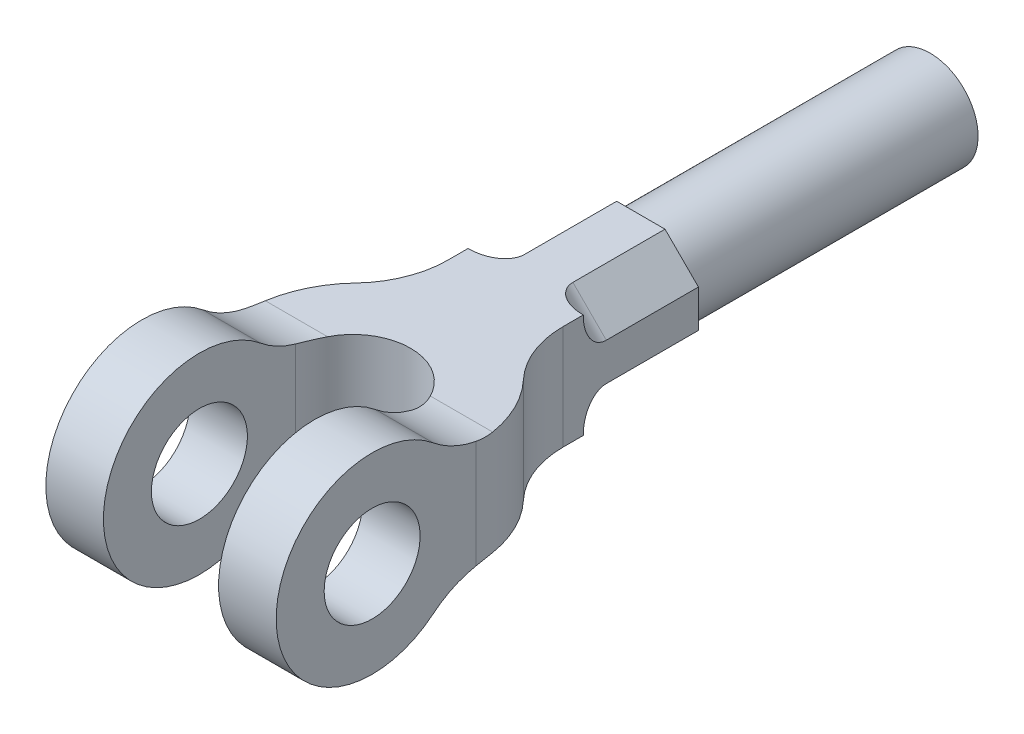
from build123d import *

# Parameters (mm, degrees)
SKETCH1_W               = 1200
SKETCH1_H               = 2500
BOSS_EXTRUDE1_DEPTH     = 1000
CUT_EXTRUDE1_DEPTH      = 1000
CUT_EXTRUDE5_DEPTH      = 2031.296104468
CUT_EXTRUDE5_DEPTH_BACK = 1200
SKETCH3_R               = 250
CUT_EXTRUDE6_DEPTH      = 600
SKETCH4_3_R             = 250
BOSS_EXTRUDE2_DEPTH     = 1507
FILLET1_R               = 120


with BuildPart() as part:
    # Sketch1 → Boss-Extrude1 (new body)
    with BuildSketch(Plane(origin=(0, 0, 0), x_dir=(1, 0, 0), z_dir=(0, 1, 0))):
        with Locations((57.423971377, 46.958855098)):
            Rectangle(SKETCH1_W, SKETCH1_H)
    extrude(amount=BOSS_EXTRUDE1_DEPTH)

    # Sketch2 → Cut-Extrude1 (cut)
    with BuildSketch(Plane(origin=(0, 1000, 0), x_dir=(1, 0, 0), z_dir=(0, 1, 0))):
        with BuildLine():
            ThreePointArc((357.423971377, -203.041144902), (57.423971377, 96.958855098), (-242.576028623, -203.041144902))
            Line((-242.576028623, -203.041144902), (-242.576028623, -1203.041144902))
            Line((-242.576028623, -1203.041144902), (357.423971377, -1203.041144902))
            Line((357.423971377, -1203.041144902), (357.423971377, -203.041144902))
        make_face()
        with BuildLine():
            Line((657.423971377, 1296.958855098), (357.423971377, 1296.958855098))
            Line((357.423971377, 1296.958855098), (357.423971377, 591.942298625))
            ThreePointArc((357.423971377, 591.942298625), (392.763782735, 407.305062156), (493.787607741, 248.768006113))
            ThreePointArc((493.787607741, 248.768006113), (615.016197748, 58.523538861), (657.423971377, -163.041144902))
            Line((657.423971377, -163.041144902), (657.423971377, 1296.958855098))
        make_face()
        with BuildLine():
            Line((-242.576028623, 591.942298625), (-242.576028623, 1296.958855098))
            Line((-242.576028623, 1296.958855098), (-542.576028623, 1296.958855098))
            Line((-542.576028623, 1296.958855098), (-542.576028623, -163.041144902))
            ThreePointArc((-542.576028623, -163.041144902), (-500.168254993, 58.523538861), (-378.939664986, 248.768006113))
            ThreePointArc((-378.939664986, 248.768006113), (-277.91583998, 407.305062156), (-242.576028623, 591.942298625))
        make_face()
    extrude(amount=-CUT_EXTRUDE1_DEPTH, mode=Mode.SUBTRACT)

    # Sketch3 → Cut-Extrude5 (cut, two sides: drawn at the far end of the back side and taken through both)
    with BuildSketch(Plane(origin=(657.423971377, 0, 0), x_dir=(0, 0, -1), z_dir=(1, 0, 0)).offset(-CUT_EXTRUDE5_DEPTH_BACK)):
        with BuildLine():
            Line((-67.360380322, 771.952048733), (1296.958855098, 771.952048733))
            Line((1296.958855098, 771.952048733), (1296.958855098, 1000))
            Line((1296.958855098, 1000), (-703.041144902, 1000))
            ThreePointArc((-703.041144902, 1000), (-534.203963249, 970.631497131), (-385.200762612, 885.976024367))
            ThreePointArc((-385.200762612, 885.976024367), (-236.197561974, 801.320551602), (-67.360380322, 771.952048733))
        make_face()
        with BuildLine():
            Line((1296.958855098, 0), (1296.958855098, 228.047951267))
            Line((1296.958855098, 228.047951267), (-67.360380322, 228.047951267))
            ThreePointArc((-67.360380322, 228.047951267), (-236.197561974, 198.679448398), (-385.200762612, 114.023975633))
            ThreePointArc((-385.200762612, 114.023975633), (-534.203964843, 29.368502297), (-703.041148287, 0))
            Line((-703.041148287, 0), (1296.958855098, 0))
        make_face()
        with BuildLine():
            ThreePointArc((-1203.041144902, 500), (-1056.594535495, 853.553390593), (-703.041144902, 1000))
            Line((-703.041144902, 1000), (-1203.041144902, 1000))
            Line((-1203.041144902, 1000), (-1203.041144902, 500))
        make_face()
        with BuildLine():
            ThreePointArc((-703.041148287, 0), (-1056.594536692, 146.446610604), (-1203.041144902, 500))
            Line((-1203.041144902, 500), (-1203.041144902, 0))
            Line((-1203.041144902, 0), (-703.041148287, 0))
        make_face()
        with Locations((-703.041144902, 500)):
            Circle(SKETCH3_R)
    extrude(amount=CUT_EXTRUDE5_DEPTH + CUT_EXTRUDE5_DEPTH_BACK, mode=Mode.SUBTRACT)

    # Sketch4 → Cut-Extrude6 (cut)
    with BuildSketch(Plane(origin=(0, 0, -1296.958855098), x_dir=(-1, 0, 0), z_dir=(0, 0, -1))):
        Polygon((68.576028623, 771.952048733), (242.576028623, 771.952048733), (242.576028623, 597.952048733), align=None)
        Polygon((-357.423971377, 771.952048733), (-357.423971377, 597.952048733), (-183.423971377, 771.952048733), align=None)
        Polygon((242.576028623, 228.047951267), (242.576028623, 402.047951267), (68.576028623, 228.047951267), align=None)
        Polygon((-183.423971377, 228.047951267), (-357.423971377, 228.047951267), (-357.423971377, 402.047951267), align=None)
    extrude(amount=-CUT_EXTRUDE6_DEPTH, mode=Mode.SUBTRACT)

    # Sketch4<3> → Boss-Extrude2 (add)
    with BuildSketch(Plane(origin=(0, 0, -1296.958855098), x_dir=(-1, 0, 0), z_dir=(0, 0, -1))):
        with Locations((-57.423971377, 500)):
            Circle(SKETCH4_3_R)
    extrude(amount=BOSS_EXTRUDE2_DEPTH)

    # Fillet1
    fillet1_edges = [part.edges().sort_by_distance(p)[0] for p in [
        (270.423971377, 315.047951267, -696.958855098),
        (270.423971377, 684.952048733, -696.958855098),
        (-155.576028623, 315.047951267, -696.958855098),
        (-155.576028623, 684.952048733, -696.958855098),
    ]]
    fillet(fillet1_edges, radius=FILLET1_R)


solid = part.part
